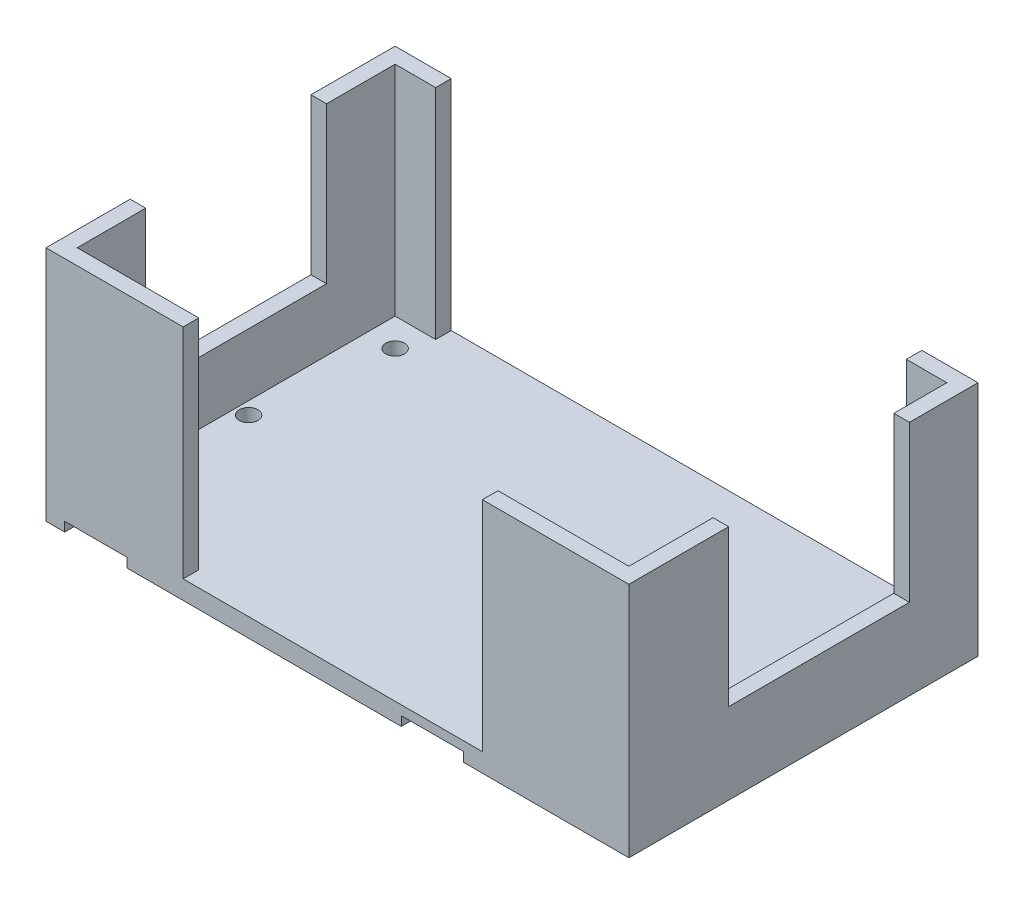
from build123d import *

# Parameters (mm, degrees)
SKETCH2_W           = 93.5
SKETCH2_H           = 56
BOSS_EXTRUDE1_DEPTH = 3
SKETCH3_R           = 1.5
CUT_EXTRUDE5_DEPTH  = 82.714205058
SKETCH5_R           = 3.025
CUT_EXTRUDE7_DEPTH  = 2.5
SKETCH6_W           = 2.5
SKETCH6_H           = 2.5
SKETCH6_W_2         = 6.5
SKETCH6_H_2         = 8.5
SKETCH6_W_3         = 21
SKETCH6_H_3         = 11
BOSS_EXTRUDE2_DEPTH = 35
SKETCH8_R           = 1.5
CUT_EXTRUDE8_DEPTH  = 89.843746591
SKETCH9_W           = 10
SKETCH9_H           = 2
CUT_EXTRUDE9_DEPTH  = 1.5
SKETCH11_W          = 2.5
SKETCH11_H          = 29
BOSS_EXTRUDE4_DEPTH = 10


with BuildPart() as part:
    # Sketch2 → Boss-Extrude1 (new body)
    with BuildSketch(Plane(origin=(0, 0, 0), x_dir=(1, 0, 0), z_dir=(0, 1, 0))):
        with Locations((-29.736211897, 0.601935214)):
            Rectangle(SKETCH2_W, SKETCH2_H)
    extrude(amount=BOSS_EXTRUDE1_DEPTH)

    # Sketch3 → Cut-Extrude5 (cut, through all)
    with BuildSketch(Plane(origin=(0, 3, 0), x_dir=(1, 0, 0), z_dir=(0, 1, 0))):
        with Locations((-13.486211897, 12.601935214)):
            Circle(SKETCH3_R)
        with Locations((-13.486211897, -11.398064786)):
            Circle(SKETCH3_R)
        with Locations((-71.986211897, 0.601935214)):
            Circle(SKETCH3_R)
    extrude(amount=-CUT_EXTRUDE5_DEPTH, mode=Mode.SUBTRACT)

    # Sketch5 → Cut-Extrude7 (cut)
    with BuildSketch(Plane(origin=(0, 0, 0), x_dir=(-1, 0, 0), z_dir=(0, -1, 0))):
        with Locations((26.486211897, 15.851935214)):
            Circle(SKETCH5_R)
        with Locations((26.486211897, -14.648064786)):
            Circle(SKETCH5_R)
        with Locations((56.986211897, -14.648064786)):
            Circle(SKETCH5_R)
        with Locations((56.986211897, 15.851935214)):
            Circle(SKETCH5_R)
    extrude(amount=-CUT_EXTRUDE7_DEPTH, mode=Mode.SUBTRACT)

    # Sketch6 → Boss-Extrude2 (add)
    with BuildSketch(Plane(origin=(0, 3, 0), x_dir=(1, 0, 0), z_dir=(0, 1, 0))):
        with Locations((15.763788103, 27.351935214)):
            Rectangle(SKETCH6_W, SKETCH6_H)
        with Locations((11.263788103, 27.351935214)):
            Rectangle(SKETCH6_W_2, SKETCH6_H)
        with Locations((15.763788103, 21.851935214)):
            Rectangle(SKETCH6_W, SKETCH6_H_2)
        Polygon((17.013788103, -11.398064786), (14.513788103, -11.398064786), (14.513788103, -24.898064786), (14.513788103, -27.398064786), (17.013788103, -27.398064786), align=None)
        with Locations((4.013788103, -26.148064786)):
            Rectangle(SKETCH6_W_3, SKETCH6_H)
        with Locations((-75.236211897, -19.398064786)):
            Rectangle(SKETCH6_W, SKETCH6_H_3)
        Polygon((-73.986211897, -24.898064786), (-76.486211897, -24.898064786), (-76.486211897, -27.398064786), (-54.486211897, -27.398064786), (-54.486211897, -24.898064786), align=None)
        Polygon((-76.486211897, 28.601935214), (-76.486211897, 26.101935214), (-73.986211897, 26.101935214), (-67.486211897, 26.101935214), (-67.486211897, 28.601935214), align=None)
        with Locations((-75.236211897, 20.601935214)):
            Rectangle(SKETCH6_W, SKETCH6_H_3)
    extrude(amount=BOSS_EXTRUDE2_DEPTH)

    # Sketch8 → Cut-Extrude8 (cut, through all)
    with BuildSketch(Plane(origin=(0, 3, 0), x_dir=(1, 0, 0), z_dir=(0, 1, 0))):
        with Locations((-69.486211897, -20.398064786)):
            Circle(SKETCH8_R)
        with Locations((-69.486211897, 21.601935214)):
            Circle(SKETCH8_R)
        with Locations((9.513788103, -20.398064786)):
            Circle(SKETCH8_R)
        with Locations((9.513788103, 21.601935214)):
            Circle(SKETCH8_R)
    extrude(amount=-CUT_EXTRUDE8_DEPTH, mode=Mode.SUBTRACT)

    # Sketch9 → Cut-Extrude9 (cut)
    with BuildSketch(Plane(origin=(0, 0, 0), x_dir=(-1, 0, 0), z_dir=(0, -1, 0))):
        with Locations((68.486211897, 27.601935214)):
            Rectangle(SKETCH9_W, SKETCH9_H)
        with Locations((68.486211897, -26.398064786)):
            Rectangle(SKETCH9_W, SKETCH9_H)
        with Locations((14.486211897, 27.601935214)):
            Rectangle(SKETCH9_W, SKETCH9_H)
        with Locations((14.486211897, -26.398064786)):
            Rectangle(SKETCH9_W, SKETCH9_H)
    extrude(amount=-CUT_EXTRUDE9_DEPTH, mode=Mode.SUBTRACT)

    # Sketch11 → Boss-Extrude4 (add)
    with BuildSketch(Plane(origin=(0, 3, 0), x_dir=(1, 0, 0), z_dir=(0, 1, 0))):
        with Locations((-75.236211897, 0.601935214)):
            Rectangle(SKETCH11_W, SKETCH11_H)
        with Locations((15.763788103, 3.101935214)):
            Rectangle(SKETCH11_W, SKETCH11_H)
    extrude(amount=BOSS_EXTRUDE4_DEPTH)


solid = part.part
